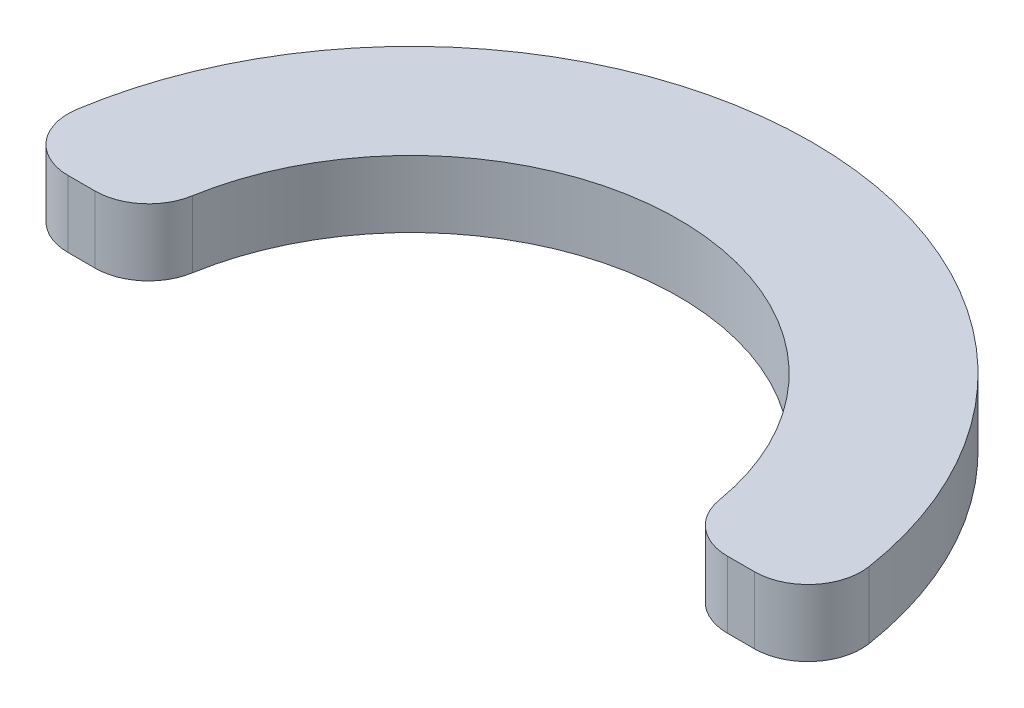
from build123d import *

# Parameters (mm, degrees)
BOSS_EXTRUDE1_DEPTH = 3.175
FILLET1_R           = 2.54


with BuildPart() as part:
    # Sketch1 → Boss-Extrude1 (new body)
    with BuildSketch(Plane(origin=(0, 0, 0), x_dir=(1, 0, 0), z_dir=(0, 1, 0))):
        with BuildLine():
            Line((-12.7, 0), (-19.05, 0))
            ThreePointArc((-19.05, 0), (0, 19.05), (19.05, 0))
            Line((19.05, 0), (12.7, 0))
            ThreePointArc((12.7, 0), (0, 12.7), (-12.7, 0))
        make_face()
    extrude(amount=BOSS_EXTRUDE1_DEPTH)

    # Fillet1
    fillet1_edges = [part.edges().sort_by_distance(p)[0] for p in [
        (-19.05, 1.5875, 0),
        (-12.7, 1.5875, 0),
        (12.7, 1.5875, 0),
        (19.05, 1.5875, 0),
    ]]
    fillet(fillet1_edges, radius=FILLET1_R)


solid = part.part
